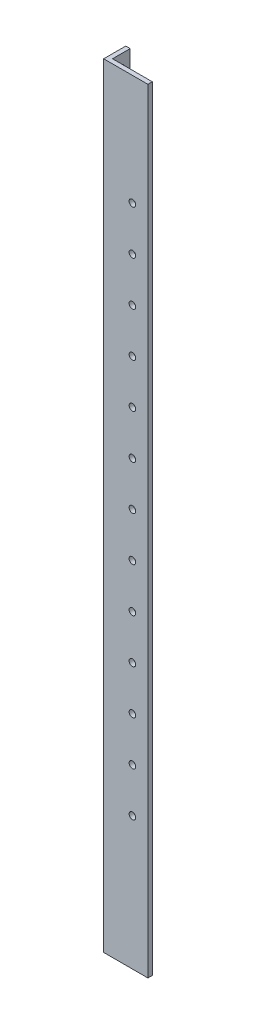
from build123d import *

# Parameters (mm, degrees)
BOSS_EXTRUDE1_DEPTH      = 350
F_3_0_3_DIAMETER_HOLE1_D = 3
F_3_0_3_DIAMETER_HOLE2_D = 3
SKETCH6_R                = 1.5
CUT_EXTRUDE1_DEPTH       = 351.713558335
LPATTERN1_COUNT          = 13
LPATTERN1_PITCH          = 20


with BuildPart() as part:
    # Sketch1 → Boss-Extrude1 (new body)
    with BuildSketch(Plane(origin=(0, 0, 0), x_dir=(1, 0, 0), z_dir=(0, 1, 0))):
        Polygon((0, 0), (0, 10), (2, 10), (2, 2), (20, 2), (20, 0), align=None)
    extrude(amount=BOSS_EXTRUDE1_DEPTH)

    # Ø3.0 (3) Diameter Hole1 (through all)
    with Locations(Plane(origin=(2, 361.407632793, -188.67995168), x_dir=(0, 0, 1), z_dir=(1, 0, 0))):
        with Locations((182.67995168, 355.407632793), (182.67995168, 341.407632793)):
            Hole(F_3_0_3_DIAMETER_HOLE1_D / 2)

    # Ø3.0 (3) Diameter Hole2 (through all)
    with Locations(Plane(origin=(2, 361.407632793, -188.67995168), x_dir=(0, 0, 1), z_dir=(1, 0, 0))):
        with Locations((182.67995168, 17.407632793), (182.67995168, 31.407632793)):
            Hole(F_3_0_3_DIAMETER_HOLE2_D / 2)

    # Sketch6 → Cut-Extrude1 (cut, through all)
    with BuildSketch(Plane.XY):
        with Locations((13.000000014, 300)):
            Circle(SKETCH6_R)
    cut_extrude1 = extrude(amount=-CUT_EXTRUDE1_DEPTH, mode=Mode.SUBTRACT)

    # LPattern1: Cut-Extrude1 ×13
    with Locations(*[(0, -i * LPATTERN1_PITCH, 0) for i in range(1, LPATTERN1_COUNT)]):
        add(cut_extrude1, mode=Mode.SUBTRACT)


solid = part.part
